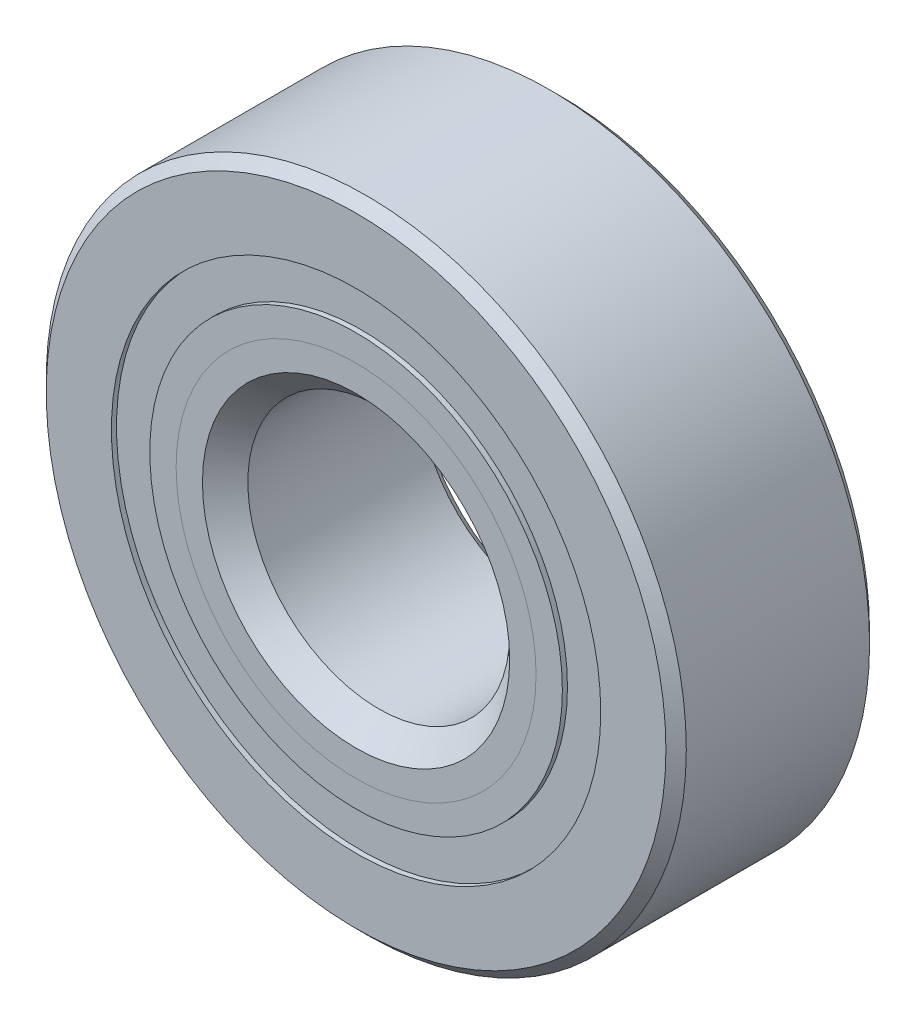
from build123d import *

# Parameters (mm, degrees)
CIRPATTERN1_COUNT = 12
SKETCH5_W         = 2.596321981
SKETCH5_H         = 2.093406594


with BuildPart() as part:
    # Sketch1 → Revolve1 (revolve)
    with BuildSketch(Plane(origin=(0, 0, 0), x_dir=(0, 0, -1), z_dir=(1, 0, 0))):
        with BuildLine():
            Line((5.000625, 17.4625), (-5.000625, 17.4625))
            Line((-5.000625, 17.4625), (-5.55625, 16.906875))
            Line((-5.55625, 16.906875), (-5.55625, 13.349828297))
            Line((-5.55625, 13.349828297), (-2.469444444, 13.349828297))
            ThreePointArc((-2.469444444, 13.349828297), (0, 14.985240519), (2.469444444, 13.349828297))
            Line((2.469444444, 13.349828297), (5.55625, 13.349828297))
            Line((5.55625, 13.349828297), (5.55625, 16.906875))
            Line((5.55625, 16.906875), (5.000625, 17.4625))
        make_face()
    revolve(axis=Axis((0, 0, 5.55625), (0, 0, -1)))


with BuildPart() as body_2:
    # Sketch2 → Revolve2 (revolve)
    with BuildSketch(Plane(origin=(0, 0, 0), x_dir=(0, 0, -1), z_dir=(1, 0, 0))):
        with BuildLine():
            Line((-5.55625, 11.256421703), (-2.469444444, 11.256421703))
            ThreePointArc((-2.469444444, 11.256421703), (-1.480939651, 10.066931492), (0, 9.621009481))
            Line((0, 9.621009481), (0, 8.382379741))
            Line((0, 8.382379741), (-4.119229019, 8.382379741))
            Line((-4.119229019, 8.382379741), (-5.55625, 9.819400722))
            Line((-5.55625, 9.819400722), (-5.55625, 11.256421703))
        make_face()
    revolve(axis=Axis((0, 0, 5.55625), (0, 0, -1)))


with BuildPart() as body_3:
    # Sketch3 → Revolve3 (revolve)
    with BuildSketch(Plane(origin=(0, 0, 0), x_dir=(0, 0, -1), z_dir=(1, 0, 0))):
        with BuildLine():
            Line((-5.55625, 9.819400722), (-4.119229019, 8.382379741))
            Line((-4.119229019, 8.382379741), (0, 8.382379741))
            Line((0, 8.382379741), (0, 9.621009481))
            ThreePointArc((0, 9.621009481), (1.480939651, 10.066931492), (2.469444444, 11.256421703))
            Line((2.469444444, 11.256421703), (5.55625, 11.256421703))
            Line((5.55625, 11.256421703), (5.55625, 7.699375))
            Line((5.55625, 7.699375), (5.000625, 7.14375))
            Line((5.000625, 7.14375), (-4.317620259, 7.14375))
            Line((-4.317620259, 7.14375), (-5.55625, 8.382379741))
            Line((-5.55625, 8.382379741), (-5.55625, 9.819400722))
        make_face()
    revolve(axis=Axis((0, 0, 5.55625), (0, 0, -1)))


with BuildPart() as body_4:
    # Sketch4 → Revolve4 (revolve)
    with BuildSketch(Plane(origin=(0, 0, 0), x_dir=(0, 0, -1), z_dir=(1, 0, 0))):
        with BuildLine():
            Line((-2.682115519, 12.303125), (2.682115519, 12.303125))
            ThreePointArc((2.682115519, 12.303125), (0, 14.985240519), (-2.682115519, 12.303125))
        make_face()
    revolve(axis=Axis((0, 12.303125, 2.682115519), (0, 0, -1)))


with BuildPart() as cirpattern1_1:
    # CirPattern1: pattern copy
    add(body_4.part.rotate(Axis((0, 0, -5.55625), (0, 0, 1)), 1 * 360 / CIRPATTERN1_COUNT))


with BuildPart() as cirpattern1_2:
    # CirPattern1: pattern copy
    add(body_4.part.rotate(Axis((0, 0, -5.55625), (0, 0, 1)), 2 * 360 / CIRPATTERN1_COUNT))


with BuildPart() as cirpattern1_3:
    # CirPattern1: pattern copy
    add(body_4.part.rotate(Axis((0, 0, -5.55625), (0, 0, 1)), 3 * 360 / CIRPATTERN1_COUNT))


with BuildPart() as cirpattern1_4:
    # CirPattern1: pattern copy
    add(body_4.part.rotate(Axis((0, 0, -5.55625), (0, 0, 1)), 4 * 360 / CIRPATTERN1_COUNT))


with BuildPart() as cirpattern1_5:
    # CirPattern1: pattern copy
    add(body_4.part.rotate(Axis((0, 0, -5.55625), (0, 0, 1)), 5 * 360 / CIRPATTERN1_COUNT))


with BuildPart() as cirpattern1_6:
    # CirPattern1: pattern copy
    add(body_4.part.rotate(Axis((0, 0, -5.55625), (0, 0, 1)), 6 * 360 / CIRPATTERN1_COUNT))


with BuildPart() as cirpattern1_7:
    # CirPattern1: pattern copy
    add(body_4.part.rotate(Axis((0, 0, -5.55625), (0, 0, 1)), 7 * 360 / CIRPATTERN1_COUNT))


with BuildPart() as cirpattern1_8:
    # CirPattern1: pattern copy
    add(body_4.part.rotate(Axis((0, 0, -5.55625), (0, 0, 1)), 8 * 360 / CIRPATTERN1_COUNT))


with BuildPart() as cirpattern1_9:
    # CirPattern1: pattern copy
    add(body_4.part.rotate(Axis((0, 0, -5.55625), (0, 0, 1)), 9 * 360 / CIRPATTERN1_COUNT))


with BuildPart() as cirpattern1_10:
    # CirPattern1: pattern copy
    add(body_4.part.rotate(Axis((0, 0, -5.55625), (0, 0, 1)), 10 * 360 / CIRPATTERN1_COUNT))


with BuildPart() as cirpattern1_11:
    # CirPattern1: pattern copy
    add(body_4.part.rotate(Axis((0, 0, -5.55625), (0, 0, 1)), 11 * 360 / CIRPATTERN1_COUNT))


with BuildPart() as body_16:
    # Sketch5 → Revolve5 (revolve)
    with BuildSketch(Plane(origin=(0, 0, 0), x_dir=(0, 0, -1), z_dir=(1, 0, 0))):
        with Locations((-3.98027651, 12.303125)):
            Rectangle(SKETCH5_W, SKETCH5_H)
        with Locations((3.98027651, 12.303125)):
            Rectangle(SKETCH5_W, SKETCH5_H)
    revolve(axis=Axis((0, 0, 5.55625), (0, 0, -1)))


solid = Compound([part.part, body_2.part, body_3.part, body_4.part, cirpattern1_1.part, cirpattern1_2.part, cirpattern1_3.part, cirpattern1_4.part, cirpattern1_5.part, cirpattern1_6.part, cirpattern1_7.part, cirpattern1_8.part, cirpattern1_9.part, cirpattern1_10.part, cirpattern1_11.part, body_16.part])
